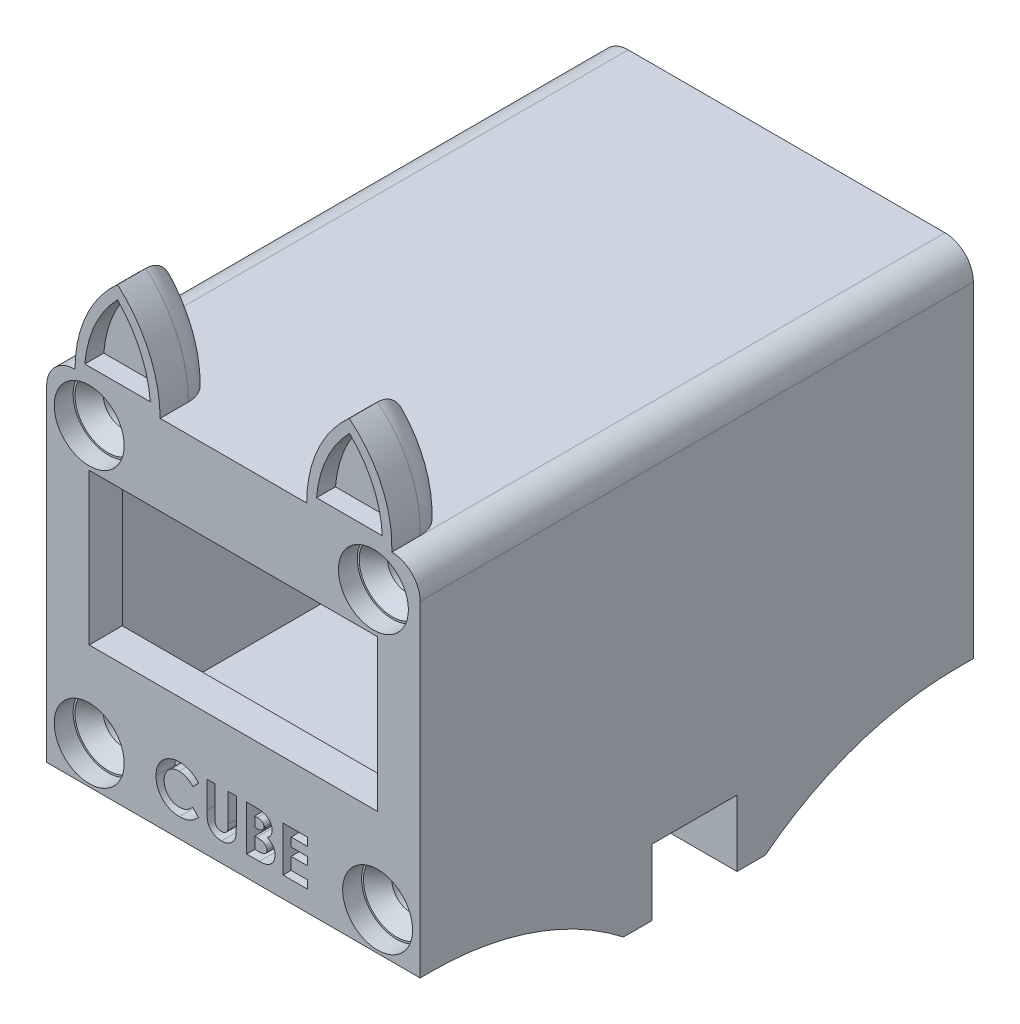
from build123d import *

# Parameters (mm, degrees)
ESQUISSE1_W              = 30.5
ESQUISSE1_H              = 16
BOSS_EXTRU_1_DEPTH       = 3.5
BOSS_EXTRU_2_START       = 55
BOSS_EXTRU_2_DEPTH       = 55
BOSS_EXTRU_3_START       = 1.5
BOSS_EXTRU_3_DEPTH       = 1.5
CONG_1_R                 = 2.5
ESQUISSE8_W              = 12.5
ESQUISSE8_H              = 5
ENL_V_MAT_EXTRU_6_DEPTH  = 2
ESQUISSE4_R              = 2
ENL_V_MAT_EXTRU_1_DEPTH  = 9.5
ESQUISSE5_R              = 3.7
ENL_V_MAT_EXTRU_5_DEPTH  = 2
CHANFREIN1_SIZE          = 1.5
BOSS_EXTRU_5_START       = -24.136848341
BOSS_EXTRU_5_OUTLINE_W   = 7.5
BOSS_EXTRU_5_OUTLINE_H   = 7
BOSS_EXTRU_5_DEPTH       = 6
BOSS_EXTRU_5_START_2     = 4.363151659
BOSS_EXTRU_5_2_OUTLINE_W = 7.5
BOSS_EXTRU_5_2_OUTLINE_H = 7
BOSS_EXTRU_5_2_DEPTH     = 6
BOSS_EXTRU_5_START_3     = -55
BOSS_EXTRU_5_3_OUTLINE_R = 2.25
BOSS_EXTRU_5_3_DEPTH     = 7
ESQUISSE7_W              = 0.5
ESQUISSE7_H              = 2.25
BOSS_EXTRU_6_DEPTH       = 7
BOSS_EXTRU_7_DEPTH       = 6
CONG_2_R                 = 3
ENL_V_MAT_EXTRU_7_DEPTH  = 2
ESQUISSE13_W             = 39.5
ESQUISSE13_H             = 3
BOSS_EXTRU_8_DEPTH       = 7
CONG_3_R                 = 33


with BuildPart() as part:
    # Esquisse1 → Boss.-Extru.1 (new body)
    with BuildSketch(Plane.XY):
        with BuildLine():
            Line((-17.882701422, 11.863151659), (15.617298578, 11.863151659))
            ThreePointArc((15.617298578, 11.863151659), (17.738618922, 10.984472002), (18.617298578, 8.863151659))
            Line((18.617298578, 8.863151659), (18.617298578, -25.636848341))
            Line((18.617298578, -25.636848341), (-20.882701422, -25.636848341))
            Line((-20.882701422, -25.636848341), (-20.882701422, 8.863151659))
            ThreePointArc((-20.882701422, 8.863151659), (-20.004021765, 10.984472002), (-17.882701422, 11.863151659))
        make_face()
        with Locations((-1.132701422, -4.636848341)):
            Rectangle(ESQUISSE1_W, ESQUISSE1_H, mode=Mode.SUBTRACT)
    extrude(amount=BOSS_EXTRU_1_DEPTH)

    # Esquisse2 → Boss.-Extru.2 (add)
    with BuildSketch(Plane(origin=(0, 0, 0), x_dir=(-1, 0, 0), z_dir=(0, 0, -1)).offset(BOSS_EXTRU_2_START)):
        with BuildLine():
            Line((-18.617298578, 8.863151659), (-18.617298578, -25.636848341))
            Line((-18.617298578, -25.636848341), (20.882701422, -25.636848341))
            Line((20.882701422, -25.636848341), (20.882701422, 8.863151659))
            ThreePointArc((20.882701422, 8.863151659), (20.004021765, 10.984472002), (17.882701422, 11.863151659))
            Line((17.882701422, 11.863151659), (-15.617298578, 11.863151659))
            ThreePointArc((-15.617298578, 11.863151659), (-17.738618922, 10.984472002), (-18.617298578, 8.863151659))
        make_face()
        with BuildLine():
            Line((-17.117298578, 8.863151659), (-17.117298578, -24.136848341))
            Line((-17.117298578, -24.136848341), (19.382701422, -24.136848341))
            Line((19.382701422, -24.136848341), (19.382701422, 8.863151659))
            ThreePointArc((19.382701422, 8.863151659), (18.943361594, 9.923811831), (17.882701422, 10.363151659))
            Line((17.882701422, 10.363151659), (-15.617298578, 10.363151659))
            ThreePointArc((-15.617298578, 10.363151659), (-16.67795875, 9.923811831), (-17.117298578, 8.863151659))
        make_face(mode=Mode.SUBTRACT)
    extrude(amount=-BOSS_EXTRU_2_DEPTH)

    # Esquisse3 → Boss.-Extru.3 (add)
    with BuildSketch(Plane(origin=(0, 0, 0), x_dir=(-1, 0, 0), z_dir=(0, 0, -1)).offset(BOSS_EXTRU_3_START)):
        with BuildLine():
            Line((-17.117298578, 8.863151659), (-17.117298578, 5.363151659))
            Line((-17.117298578, 5.363151659), (-5.117298578, 5.363151659))
            Line((-5.117298578, 5.363151659), (-5.117298578, 10.363151659))
            Line((-5.117298578, 10.363151659), (-15.617298578, 10.363151659))
            ThreePointArc((-15.617298578, 10.363151659), (-16.67795875, 9.923811831), (-17.117298578, 8.863151659))
        make_face()
        with BuildLine():
            Line((7.382701422, 5.363151659), (19.382701422, 5.363151659))
            Line((19.382701422, 5.363151659), (19.382701422, 8.863151659))
            ThreePointArc((19.382701422, 8.863151659), (18.943361594, 9.923811831), (17.882701422, 10.363151659))
            Line((17.882701422, 10.363151659), (7.382701422, 10.363151659))
            Line((7.382701422, 10.363151659), (7.382701422, 5.363151659))
        make_face()
        Polygon((-17.117298578, -19.136848341), (-17.117298578, -24.136848341), (19.382701422, -24.136848341), (19.382701422, -19.136848341), (7.382701422, -19.136848341), (7.382701422, -21.636848341), (-5.117298578, -21.636848341), (-5.117298578, -19.136848341), align=None)
    extrude(amount=-BOSS_EXTRU_3_DEPTH)

    # Congé1
    # the kernel refuses this fillet: 2.5 mm, written as the material it takes off along each edge
    with BuildSketch(Plane(origin=(-7.382701422, -21.636848341, -1.5), x_dir=(0, -1, 0), z_dir=(1, 0, 0))) as cong_1_piece_1:
        with BuildLine():
            CenterArc((2.291287847, -2.5), CONG_1_R, 90, 66.421821522)
            Line((0, -1.5), (-0.045825757, -1.48))
            ThreePointArc((-0.045825757, -1.48), (-0.05, -0.75), (-0.05, 0))
            Line((-0.05, 0), (0, 0.05))
            Line((0, 0.05), (2.291287847, 0.05))
            Line((2.291287847, 0.05), (2.291287847, 0))
        make_face()
    extrude(amount=12.5, mode=Mode.SUBTRACT)

    # Esquisse8 → Enlèv. mat.-Extru.6 (cut)
    with BuildSketch(Plane(origin=(0, 0, 0), x_dir=(-1, 0, 0), z_dir=(0, 0, -1))):
        with Locations((1.132701422, 7.863151659)):
            Rectangle(ESQUISSE8_W, ESQUISSE8_H)
    extrude(amount=-ENL_V_MAT_EXTRU_6_DEPTH, mode=Mode.SUBTRACT)

    # Esquisse4 → Enlèv. mat.-Extru.1 (cut)
    with BuildSketch(Plane.XY.offset(3.5)):
        with Locations((-16.382701422, 7.463151659)):
            Circle(ESQUISSE4_R)
        with Locations((13.672123748, 7.463151659)):
            Circle(ESQUISSE4_R)
        with Locations((14.117298578, -21.636848341)):
            Circle(ESQUISSE4_R)
        with Locations((-16.382701422, -21.636848341)):
            Circle(ESQUISSE4_R)
    extrude(amount=-ENL_V_MAT_EXTRU_1_DEPTH, mode=Mode.SUBTRACT)

    # Esquisse5 → Enlèv. mat.-Extru.5 (cut)
    # profile 1 of 8: a face of its own
    with BuildSketch(Plane.XY.offset(3.5)):
        with Locations((-16.382701422, -21.636848341)):
            Circle(ESQUISSE5_R)
    # profile 2 of 8: a face of its own
    with BuildSketch(Plane.XY.offset(3.5)):
        with Locations((13.672123748, 7.463151659)):
            Circle(ESQUISSE5_R)
    # profile 3 of 8: a face of its own
    with BuildSketch(Plane.XY.offset(3.5)):
        with Locations((-16.382701422, 7.463151659)):
            Circle(ESQUISSE5_R)
    # profile 4 of 8: a face of its own
    with BuildSketch(Plane.XY.offset(3.5)):
        with Locations((14.117298578, -21.636848341)):
            Circle(ESQUISSE5_R)
    # profile 5 of 8: a face of its own
    with BuildSketch(Plane.XY.offset(3.5)):
        with BuildLine():
            Line((-4.79616296, -19.522025097), (-5.422958333, -20.121153702))
            add(Edge.make_bspline(
                [(-5.422958333, -20.121153702), (-5.476128223, -20.066175947), (-5.579985675, -19.958787167), (-5.747339116, -19.816613886), (-5.9213806, -19.698131693), (-6.098724499, -19.598346745), (-6.282560715, -19.52285232), (-6.470763601, -19.467838261), (-6.664534888, -19.434298268), (-6.795671842, -19.430460699), (-6.861630208, -19.428530505)],
                knots=[0, 0, 0, 0, 1.115251505, 2.178435587, 3.19620269, 4.182487026, 5.141301733, 6.088180966, 7.038406374, 8, 8, 8, 8], degree=3))
            add(Edge.make_bspline(
                [(-6.861630208, -19.428530505), (-6.916713459, -19.430055426), (-7.025414185, -19.433064689), (-7.185015337, -19.455125555), (-7.337682087, -19.492641019), (-7.483937038, -19.544344276), (-7.623349827, -19.611245548), (-7.756212753, -19.693293053), (-7.882198246, -19.789745786), (-7.999642111, -19.900104696), (-8.107075631, -20.020680098), (-8.201999987, -20.149333765), (-8.281514362, -20.285770958), (-8.346770516, -20.428609942), (-8.397602537, -20.578511845), (-8.433902987, -20.735375748), (-8.454898197, -20.899388464), (-8.458031872, -21.010883086), (-8.459624499, -21.067547933)],
                knots=[0, 0, 0, 0, 1.035432265, 2.043311493, 3.022114605, 3.98653278, 4.95457646, 5.923598177, 6.917315552, 7.932509744, 8.948865224, 9.949768934, 10.933144597, 11.912367597, 12.897413939, 13.903909035, 14.934704909, 16, 16, 16, 16], degree=3))
            add(Edge.make_bspline(
                [(-8.459624499, -21.067547933), (-8.459165522, -21.107319287), (-8.458260869, -21.185709444), (-8.448357848, -21.301670242), (-8.432411647, -21.41417963), (-8.409333545, -21.523067187), (-8.380474151, -21.628427276), (-8.34661551, -21.731168832), (-8.304140344, -21.8298722), (-8.256992268, -21.925683753), (-8.202159599, -22.015989155), (-8.143039867, -22.102102851), (-8.07893417, -22.183602719), (-8.009427291, -22.260155586), (-7.933541008, -22.330565102), (-7.853236701, -22.396948565), (-7.767159746, -22.457644171), (-7.67709818, -22.514175145), (-7.582273986, -22.563284083), (-7.485259963, -22.607767293), (-7.384585183, -22.643894273), (-7.281475423, -22.673015915), (-7.17629916, -22.697779522), (-7.068027672, -22.713027236), (-6.957599538, -22.724574151), (-6.882968655, -22.725287106), (-6.845411758, -22.72564589)],
                knots=[0, 0, 0, 0, 1.103660481, 2.175337485, 3.227646561, 4.255952547, 5.262355991, 6.258840057, 7.255597736, 8.242457506, 9.22035537, 10.185017736, 11.140346927, 12.096287581, 13.051739095, 14.01125915, 14.986044842, 15.97314143, 16.960198552, 17.947847494, 18.933482797, 19.925264591, 20.920966487, 21.929612487, 22.958107872, 24, 24, 24, 24], degree=3))
            add(Edge.make_bspline(
                [(-6.845411758, -22.72564589), (-6.781708807, -22.723803262), (-6.656549074, -22.720182979), (-6.472859169, -22.691872873), (-6.29782099, -22.645304351), (-6.157966322, -22.590309633), (-6.048393884, -22.536001635), (-5.964978007, -22.485769411), (-5.878719488, -22.429579153), (-5.791051009, -22.36531018), (-5.700986472, -22.293733746), (-5.610115724, -22.213282193), (-5.516112458, -22.126604675), (-5.454531851, -22.064741228), (-5.422958333, -22.033022693)],
                knots=[0, 0, 0, 0, 1.404581149, 2.759636711, 4.088442092, 5.392261763, 6.066678138, 6.783632037, 7.538459478, 8.336747902, 9.180226004, 10.074962426, 11.012997595, 12, 12, 12, 12], degree=3))
            Line((-5.422958333, -22.033022693), (-4.815243489, -22.671266383))
            add(Edge.make_bspline(
                [(-4.815243489, -22.671266383), (-4.857962572, -22.712510316), (-4.941341085, -22.793009652), (-5.067115257, -22.907311199), (-5.192731138, -23.010023845), (-5.315154109, -23.104875609), (-5.436389586, -23.18910323), (-5.556424712, -23.262790825), (-5.673900638, -23.327802062), (-5.791256788, -23.383040557), (-5.909223413, -23.429943776), (-6.030597208, -23.470324369), (-6.155749223, -23.504484899), (-6.285443829, -23.532047959), (-6.418471315, -23.554149813), (-6.55607664, -23.569068436), (-6.69738732, -23.579097731), (-6.793240544, -23.579998946), (-6.841595653, -23.580453582)],
                knots=[0, 0, 0, 0, 1.244526981, 2.429050516, 3.560637417, 4.644440555, 5.67424972, 6.652764056, 7.595344123, 8.486817594, 9.369275933, 10.254498637, 11.166417451, 12.086725134, 13.032340136, 13.991389299, 14.986715468, 16, 16, 16, 16], degree=3))
            add(Edge.make_bspline(
                [(-6.841595653, -23.580453582), (-6.930417997, -23.578189323), (-7.104218637, -23.573758799), (-7.358918942, -23.540931609), (-7.600877395, -23.485897403), (-7.830682635, -23.408063857), (-8.04826159, -23.30863515), (-8.253558596, -23.186740224), (-8.44624276, -23.042702934), (-8.624757574, -22.878211537), (-8.786232719, -22.696544599), (-8.928958047, -22.501484145), (-9.047020444, -22.292071527), (-9.145050197, -22.071400435), (-9.221708173, -21.838463864), (-9.275662394, -21.593009846), (-9.308935567, -21.335275383), (-9.3125757, -21.159236804), (-9.314432191, -21.069455986)],
                knots=[0, 0, 0, 0, 1.078019885, 2.10938526, 3.111377082, 4.085535484, 5.04941344, 6.010039228, 6.978205633, 7.964457913, 8.951525778, 9.924444315, 10.892603023, 11.863865945, 12.85144698, 13.863884204, 14.910567087, 16, 16, 16, 16], degree=3))
            add(Edge.make_bspline(
                [(-9.314432191, -21.069455986), (-9.313647728, -21.010901703), (-9.312093114, -20.894861425), (-9.295753973, -20.723924693), (-9.272976261, -20.557291956), (-9.236841492, -20.396693414), (-9.193284592, -20.239965506), (-9.139115864, -20.088811684), (-9.074421823, -19.942797515), (-9.00128771, -19.801678564), (-8.91855182, -19.66637931), (-8.826126748, -19.538062187), (-8.726391876, -19.415736611), (-8.616950738, -19.301025457), (-8.499393656, -19.19292154), (-8.373189874, -19.092010695), (-8.239098445, -18.996845747), (-8.096756432, -18.909880768), (-7.948929162, -18.831216323), (-7.797481126, -18.761830923), (-7.642784415, -18.703840706), (-7.485493098, -18.655739961), (-7.324942624, -18.619836155), (-7.162278961, -18.592658133), (-6.996118035, -18.577465445), (-6.884555368, -18.574978305), (-6.828239282, -18.573722813)],
                knots=[0, 0, 0, 0, 1.071919942, 2.124283339, 3.142214191, 4.149696895, 5.136002878, 6.119640489, 7.086990633, 8.058538607, 9.028339693, 9.988281803, 10.952401235, 11.916291999, 12.888973767, 13.874849856, 14.873389453, 15.898127285, 16.927174885, 17.938320013, 18.946391617, 19.950418109, 20.947802303, 21.956882652, 22.968648068, 24, 24, 24, 24], degree=3))
            add(Edge.make_bspline(
                [(-6.828239282, -18.573722813), (-6.780195887, -18.574442492), (-6.684608614, -18.575874368), (-6.542263123, -18.587810608), (-6.401056046, -18.606556354), (-6.261492945, -18.634839692), (-6.122575524, -18.668415588), (-5.986129313, -18.712378592), (-5.850001799, -18.761383646), (-5.71632794, -18.819959181), (-5.584921146, -18.883899669), (-5.45885983, -18.956442474), (-5.336027433, -19.033123394), (-5.219145847, -19.118480741), (-5.106025629, -19.209418445), (-4.997258294, -19.306360783), (-4.893798339, -19.410924067), (-4.828872616, -19.484804199), (-4.79616296, -19.522025097)],
                knots=[0, 0, 0, 0, 0.996412454, 1.982464992, 2.961075852, 3.949442424, 4.934965278, 5.923860011, 6.921385422, 7.934793307, 8.949617135, 9.951082467, 10.950285876, 11.951772932, 12.951063433, 13.960125323, 14.972308753, 16, 16, 16, 16], degree=3))
        make_face()
    # profile 6 of 8: a face of its own
    with BuildSketch(Plane.XY.offset(3.5)):
        with BuildLine():
            Line((-3.941355268, -18.695838198), (-3.086547576, -18.695838198))
            Line((-3.086547576, -18.695838198), (-3.086547576, -21.794516082))
            add(Edge.make_bspline(
                [(-3.086547576, -21.794516082), (-3.086501095, -21.82664183), (-3.086411319, -21.888692381), (-3.081917082, -21.977714606), (-3.077804545, -22.059544671), (-3.070384361, -22.134092987), (-3.059422206, -22.201391446), (-3.048807263, -22.261872347), (-3.034440987, -22.31445285), (-3.012850772, -22.374303228), (-2.979587337, -22.441548396), (-2.92523673, -22.511632853), (-2.862520779, -22.575595093), (-2.7873521, -22.628834838), (-2.702869152, -22.671900993), (-2.609536132, -22.703808247), (-2.507484605, -22.721544444), (-2.436921573, -22.7242522), (-2.400602564, -22.72564589)],
                knots=[0, 0, 0, 0, 1.155499968, 2.231836252, 3.205919964, 4.102923608, 4.924856345, 5.658536265, 6.31071849, 6.882491295, 7.94666036, 8.992281882, 10.060072772, 11.158554251, 12.289267114, 13.461410017, 14.693379945, 16, 16, 16, 16], degree=3))
            add(Edge.make_bspline(
                [(-2.400602564, -22.72564589), (-2.362018098, -22.724519967), (-2.286784923, -22.722324609), (-2.178573978, -22.700774789), (-2.078315923, -22.666460095), (-1.988133564, -22.617484282), (-1.908116647, -22.558778187), (-1.840384003, -22.491834842), (-1.78692965, -22.416520728), (-1.752090091, -22.347037723), (-1.732529394, -22.283084668), (-1.717867678, -22.22594504), (-1.707119017, -22.158525934), (-1.697367479, -22.081880247), (-1.691507556, -21.995214075), (-1.685153425, -21.899224399), (-1.682824577, -21.793254433), (-1.682427642, -21.719465557), (-1.682220653, -21.680986936)],
                knots=[0, 0, 0, 0, 1.261321664, 2.459363699, 3.594844139, 4.716940403, 5.803436589, 6.833651888, 7.818396249, 8.814403945, 9.360733334, 10.004355033, 10.743453831, 11.592799886, 12.532235708, 13.585170094, 14.740740724, 16, 16, 16, 16], degree=3))
            Line((-1.682220653, -21.680986936), (-1.682220653, -18.695838198))
            Line((-1.682220653, -18.695838198), (-0.82741296, -18.695838198))
            Line((-0.82741296, -18.695838198), (-0.82741296, -21.536928943))
            add(Edge.make_bspline(
                [(-0.82741296, -21.536928943), (-0.827531666, -21.594489305), (-0.827759925, -21.705172269), (-0.831265299, -21.864231477), (-0.838727607, -22.00950655), (-0.844995084, -22.141039935), (-0.857124799, -22.258654437), (-0.869761117, -22.362852302), (-0.885867191, -22.453264277), (-0.909832061, -22.556187323), (-0.951188332, -22.674699442), (-1.017860063, -22.811161009), (-1.102495509, -22.944765148), (-1.202530378, -23.074042124), (-1.315478894, -23.194136267), (-1.438836749, -23.299563381), (-1.570644092, -23.38874335), (-1.712278216, -23.459495618), (-1.863618583, -23.514677053), (-2.026162592, -23.551756198), (-2.199799403, -23.576807333), (-2.319733629, -23.579213803), (-2.381522035, -23.580453582)],
                knots=[0, 0, 0, 0, 1.170808336, 2.251350247, 3.235597562, 4.129743112, 4.929140599, 5.639994148, 6.264258765, 6.79612947, 7.788252245, 8.809469599, 9.879094798, 10.999557536, 12.129761673, 13.226370002, 14.293821979, 15.358369427, 16.438775801, 17.562147481, 18.744053101, 20, 20, 20, 20], degree=3))
            add(Edge.make_bspline(
                [(-2.381522035, -23.580453582), (-2.422575481, -23.579762091), (-2.503573087, -23.578397793), (-2.622694277, -23.566368251), (-2.737848307, -23.54864123), (-2.848818803, -23.52277933), (-2.955990924, -23.489370587), (-3.059336196, -23.44824675), (-3.158470563, -23.399637204), (-3.252839283, -23.343989052), (-3.342326228, -23.283815154), (-3.424112676, -23.217109855), (-3.501013091, -23.148806264), (-3.570805853, -23.076029876), (-3.634015167, -22.999544719), (-3.690510853, -22.919177451), (-3.740208978, -22.834935213), (-3.78435967, -22.745299542), (-3.822148354, -22.645714581), (-3.854005634, -22.532638051), (-3.881836903, -22.404297592), (-3.90251946, -22.260404059), (-3.921270388, -22.101431708), (-3.933138692, -21.926966393), (-3.939347536, -21.737003108), (-3.940669113, -21.605305501), (-3.941355268, -21.536928943)],
                knots=[0, 0, 0, 0, 1.001158378, 1.975264943, 2.917723546, 3.841610987, 4.75185031, 5.653588123, 6.552117133, 7.442167995, 8.324307438, 9.179605724, 10.014504199, 10.831958861, 11.636465792, 12.43274043, 13.225645099, 14.020104002, 14.867201867, 15.819789774, 16.883317127, 18.068162734, 19.364263498, 20.787406516, 22.332041935, 24, 24, 24, 24], degree=3))
            Line((-3.941355268, -21.536928943), (-3.941355268, -18.695838198))
        make_face()
    # profile 7 of 8: a face of its own
    with BuildSketch(Plane.XY.offset(3.5)):
        with BuildLine():
            Line((0.271625501, -23.458338198), (0.271625501, -18.695838198))
            Line((0.271625501, -18.695838198), (1.034846655, -18.695838198))
            add(Edge.make_bspline(
                [(1.034846655, -18.695838198), (1.088276908, -18.6958321), (1.191663435, -18.695820301), (1.340823211, -18.701058303), (1.479156307, -18.707834244), (1.606222492, -18.715414948), (1.722238043, -18.728478014), (1.827026538, -18.742245059), (1.920797346, -18.758847267), (1.978770741, -18.773739962), (2.006045573, -18.780746551)],
                knots=[0, 0, 0, 0, 1.311965854, 2.538629056, 3.664479157, 4.713267157, 5.663616078, 6.530575999, 7.308677837, 8, 8, 8, 8], degree=3))
            add(Edge.make_bspline(
                [(2.006045573, -18.780746551), (2.041860197, -18.790629469), (2.112139987, -18.810022928), (2.212803073, -18.849188857), (2.308296052, -18.892724563), (2.398502329, -18.942390661), (2.482868003, -18.998786761), (2.561072454, -19.062360437), (2.634802359, -19.130559847), (2.701439738, -19.205285688), (2.761668949, -19.284247381), (2.813997335, -19.367424236), (2.859463995, -19.453544424), (2.895849233, -19.543691712), (2.923264826, -19.637450946), (2.943316476, -19.734421759), (2.956312661, -19.834910993), (2.95754063, -19.903277102), (2.958163963, -19.937980625)],
                knots=[0, 0, 0, 0, 1.099996261, 2.158545794, 3.195537121, 4.207578794, 5.205712374, 6.197378256, 7.190519799, 8.17788031, 9.159561366, 10.129234751, 11.085776129, 12.040971148, 13.00380137, 13.975669004, 14.972423361, 16, 16, 16, 16], degree=3))
            add(Edge.make_bspline(
                [(2.958163963, -19.937980625), (2.956534132, -19.982565543), (2.953326011, -20.070325476), (2.932832315, -20.19922894), (2.894403441, -20.321061241), (2.844120195, -20.438067703), (2.7757507, -20.54981189), (2.688934665, -20.656240672), (2.585078224, -20.76063115), (2.505414601, -20.8232062), (2.463978266, -20.855754063)],
                knots=[0, 0, 0, 0, 0.986156485, 1.941127874, 2.875419072, 3.804401753, 4.751181392, 5.761612777, 6.835722519, 8, 8, 8, 8], degree=3))
            add(Edge.make_bspline(
                [(2.463978266, -20.855754063), (2.497556284, -20.87289535), (2.563393487, -20.906504671), (2.656862974, -20.961748363), (2.743405516, -21.020507035), (2.823409143, -21.081598439), (2.895195688, -21.14761233), (2.961729338, -21.214744895), (3.019727668, -21.286842552), (3.071591522, -21.361335603), (3.116670742, -21.439302715), (3.155929771, -21.520612221), (3.189090465, -21.60554189), (3.217171798, -21.6936595), (3.238114864, -21.785268134), (3.251770188, -21.880400556), (3.262225558, -21.978732314), (3.263038887, -22.045713452), (3.263452424, -22.079769988)],
                knots=[0, 0, 0, 0, 1.164658916, 2.283573913, 3.35186032, 4.395461096, 5.390182219, 6.362969632, 7.312859996, 8.245001507, 9.165155236, 10.092416118, 11.032087915, 11.979892451, 12.947605196, 13.931445124, 14.948243989, 16, 16, 16, 16], degree=3))
            add(Edge.make_bspline(
                [(3.263452424, -22.079769988), (3.260768845, -22.144816026), (3.255472812, -22.27318412), (3.216750801, -22.461657964), (3.149619138, -22.640348263), (3.059475158, -22.808544824), (2.94840043, -22.961378634), (2.820696346, -23.095259725), (2.677648593, -23.208587097), (2.545669751, -23.28507428), (2.431518446, -23.336404333), (2.336969053, -23.368139809), (2.235425009, -23.397539506), (2.125026271, -23.41818458), (2.007774217, -23.437081222), (1.882525634, -23.4487484), (1.749514607, -23.456654959), (1.658156884, -23.457765775), (1.611078626, -23.458338198)],
                knots=[0, 0, 0, 0, 1.284142165, 2.534249414, 3.780121997, 5.041676246, 6.291546858, 7.49970053, 8.684500223, 9.883330709, 10.50184324, 11.153274765, 11.851151195, 12.587658647, 13.369265475, 14.195992086, 15.070362669, 16, 16, 16, 16], degree=3))
            Line((1.611078626, -23.458338198), (0.271625501, -23.458338198))
        make_face()
        with BuildLine():
            Line((1.126433194, -19.55064589), (1.126433194, -20.588626659))
            Line((1.126433194, -20.588626659), (1.353491487, -20.588626659))
            add(Edge.make_bspline(
                [(1.353491487, -20.588626659), (1.384350749, -20.588357555), (1.443922687, -20.587838065), (1.529968032, -20.581147216), (1.609976307, -20.569732212), (1.683644059, -20.553805411), (1.751657528, -20.533580695), (1.813582225, -20.509246007), (1.869145878, -20.479555042), (1.933697992, -20.435329039), (2.001934232, -20.370248496), (2.062001826, -20.276226167), (2.097381238, -20.168100847), (2.101321551, -20.091842499), (2.103356271, -20.052463799)],
                knots=[0, 0, 0, 0, 1.065314748, 2.056525647, 2.977365736, 3.853934255, 4.656397591, 5.425096493, 6.14721249, 6.826394842, 8.123232004, 9.372140726, 10.643011755, 12, 12, 12, 12], degree=3))
            add(Edge.make_bspline(
                [(2.103356271, -20.052463799), (2.101728122, -20.015579103), (2.098580163, -19.944264027), (2.062957644, -19.844131309), (2.007628829, -19.755393228), (1.942305387, -19.694659268), (1.880790672, -19.653179764), (1.828117999, -19.625867277), (1.770305785, -19.601417418), (1.706234847, -19.582722459), (1.636271066, -19.568694421), (1.560754296, -19.558392507), (1.479554242, -19.551380586), (1.423469193, -19.550896041), (1.394514624, -19.55064589)],
                knots=[0, 0, 0, 0, 1.347982417, 2.606269829, 3.849316587, 5.153353503, 5.842674298, 6.568177932, 7.326619318, 8.142485038, 9.012069166, 9.942760135, 10.937925643, 12, 12, 12, 12], degree=3))
            Line((1.394514624, -19.55064589), (1.126433194, -19.55064589))
        make_face(mode=Mode.SUBTRACT)
        with BuildLine():
            Line((1.126433194, -21.382376659), (1.126433194, -22.603530505))
            Line((1.126433194, -22.603530505), (1.372572016, -22.603530505))
            add(Edge.make_bspline(
                [(1.372572016, -22.603530505), (1.421233974, -22.603252501), (1.514792662, -22.602718004), (1.648815316, -22.596260005), (1.770675414, -22.584620601), (1.880050073, -22.570089742), (1.977106821, -22.550402701), (2.061517583, -22.525373152), (2.134439943, -22.497836288), (2.195436655, -22.463824991), (2.245267474, -22.424244276), (2.290234564, -22.383791835), (2.326897927, -22.337126122), (2.355906664, -22.286250367), (2.381013674, -22.232428361), (2.39615645, -22.173558373), (2.407685628, -22.111385169), (2.40832011, -22.068381309), (2.408644732, -22.046379063)],
                knots=[0, 0, 0, 0, 1.753078804, 3.370512758, 4.83203934, 6.162291463, 7.344201807, 8.395507345, 9.331626367, 10.147333109, 10.898971645, 11.62040215, 12.321813352, 13.025280112, 13.727906689, 14.453419512, 15.208716525, 16, 16, 16, 16], degree=3))
            add(Edge.make_bspline(
                [(2.408644732, -22.046379063), (2.407928846, -22.021219149), (2.406534494, -21.972214404), (2.395146798, -21.90058874), (2.374451636, -21.83372143), (2.348385069, -21.769902588), (2.312112056, -21.711417149), (2.26900282, -21.656241154), (2.216915857, -21.606243034), (2.158341029, -21.558398715), (2.090019292, -21.516508421), (2.01191859, -21.480161171), (1.923614639, -21.449805287), (1.824833907, -21.425635912), (1.716009442, -21.405123697), (1.596346944, -21.39287564), (1.466843004, -21.383766223), (1.377042865, -21.382850372), (1.330594852, -21.382376659)],
                knots=[0, 0, 0, 0, 0.845221588, 1.646264278, 2.427170338, 3.19324141, 3.95557735, 4.731569926, 5.540061037, 6.376114724, 7.268642756, 8.224665384, 9.265483498, 10.400594375, 11.639216012, 12.983232105, 14.439614077, 16, 16, 16, 16], degree=3))
            Line((1.330594852, -21.382376659), (1.126433194, -21.382376659))
        make_face(mode=Mode.SUBTRACT)
    # profile 8 of 8: a face of its own
    with BuildSketch(Plane.XY.offset(3.5)):
        Polygon((4.118260117, -18.695838198), (6.682683194, -18.695838198), (6.682683194, -19.55064589), (4.973067809, -19.55064589), (4.973067809, -20.466511274), (6.682683194, -20.466511274), (6.682683194, -21.321318967), (4.973067809, -21.321318967), (4.973067809, -22.603530505), (6.682683194, -22.603530505), (6.682683194, -23.458338198), (4.118260117, -23.458338198), align=None)
    extrude(amount=-ENL_V_MAT_EXTRU_5_DEPTH, mode=Mode.SUBTRACT)

    # Chanfrein1
    chanfrein1_edges = [part.edges().sort_by_distance(p)[0] for p in [
        (-18.382701422, -21.636848341, 1.5),
        (11.672123748, 7.463151659, 1.5),
        (-18.382701422, 7.463151659, 1.5),
        (12.117298578, -21.636848341, 1.5),
    ]]
    chamfer(chanfrein1_edges, length=CHANFREIN1_SIZE)

    # Boss.-Extru.5: read off the stored shape, not the designer's step
    # Boss.-Extru.5 outline → Boss.-Extru.5 (add)
    with BuildSketch(Plane(origin=(0, 0, 0), x_dir=(1, 0, 0), z_dir=(0, 1, 0)).offset(BOSS_EXTRU_5_START)):
        with Locations((-1.132701422, 51.5)):
            Rectangle(BOSS_EXTRU_5_OUTLINE_W, BOSS_EXTRU_5_OUTLINE_H)
    extrude(amount=BOSS_EXTRU_5_DEPTH)

    # Boss.-Extru.5 2 outline → Boss.-Extru.5 2 (add)
    with BuildSketch(Plane(origin=(0, 0, 0), x_dir=(1, 0, 0), z_dir=(0, 1, 0)).offset(BOSS_EXTRU_5_START_2)):
        with Locations((-1.132701422, 51.5)):
            Rectangle(BOSS_EXTRU_5_2_OUTLINE_W, BOSS_EXTRU_5_2_OUTLINE_H)
    extrude(amount=BOSS_EXTRU_5_2_DEPTH)

    # Boss.-Extru.5 3 outline → Boss.-Extru.5 3 (cut)
    with BuildSketch(Plane.XY.offset(BOSS_EXTRU_5_START_3)):
        with BuildLine():
            Line((-4.882701422, -18.136848341), (-4.882701422, -21.886848341))
            ThreePointArc((-4.882701422, -21.886848341), (-3.784351851, -19.235197912), (-1.132701422, -18.136848341))
            Line((-1.132701422, -18.136848341), (-4.882701422, -18.136848341))
        make_face()
        with BuildLine():
            Line((2.617298578, -18.136848341), (-1.132701422, -18.136848341))
            ThreePointArc((-1.132701422, -18.136848341), (1.518949007, -19.235197912), (2.617298578, -21.886848341))
            Line((2.617298578, -21.886848341), (2.617298578, -18.136848341))
        make_face()
        with Locations((-1.132701422, -21.886848341)):
            Circle(BOSS_EXTRU_5_3_OUTLINE_R)
        with BuildLine():
            Line((2.617298578, 4.363151659), (2.617298578, 8.113151659))
            ThreePointArc((2.617298578, 8.113151659), (1.518949007, 5.46150123), (-1.132701422, 4.363151659))
            Line((-1.132701422, 4.363151659), (2.617298578, 4.363151659))
        make_face()
        with BuildLine():
            Line((-4.882701422, 4.363151659), (-1.132701422, 4.363151659))
            ThreePointArc((-1.132701422, 4.363151659), (-3.784351851, 5.46150123), (-4.882701422, 8.113151659))
            Line((-4.882701422, 8.113151659), (-4.882701422, 4.363151659))
        make_face()
        with Locations((-1.132701422, 8.113151659)):
            Circle(BOSS_EXTRU_5_3_OUTLINE_R)
    extrude(amount=BOSS_EXTRU_5_3_DEPTH, mode=Mode.SUBTRACT)

    # Esquisse7 → Boss.-Extru.6 (add)
    with BuildSketch(Plane(origin=(0, 0, -55), x_dir=(-1, 0, 0), z_dir=(0, 0, -1))):
        with BuildLine():
            Line((-2.617298578, 8.113151659), (-3.117298578, 8.113151659))
            ThreePointArc((-3.117298578, 8.113151659), (1.132701422, 3.863151659), (5.382701422, 8.113151659))
            Line((5.382701422, 8.113151659), (4.882701422, 8.113151659))
            ThreePointArc((4.882701422, 8.113151659), (1.132701422, 4.363151659), (-2.617298578, 8.113151659))
        make_face()
        with Locations((5.132701422, 9.238151659)):
            Rectangle(ESQUISSE7_W, ESQUISSE7_H)
        with Locations((-2.867298578, 9.238151659)):
            Rectangle(ESQUISSE7_W, ESQUISSE7_H)
    extrude(amount=-BOSS_EXTRU_6_DEPTH)

    # Esquisse10 → Boss.-Extru.7 (add)
    with BuildSketch(Plane.XY.offset(3.5)):
        with BuildLine():
            ThreePointArc((11.117298578, 21.863151659), (7.794125134, 17.346079709), (6.617298578, 11.863151659))
            Line((6.617298578, 11.863151659), (15.617298578, 11.863151659))
            ThreePointArc((15.617298578, 11.863151659), (14.552498082, 17.396491435), (11.117298578, 21.863151659))
        make_face()
        with BuildLine():
            ThreePointArc((-13.382701422, 21.863151659), (-16.705874866, 17.346079709), (-17.882701422, 11.863151659))
            Line((-17.882701422, 11.863151659), (-8.882701422, 11.863151659))
            ThreePointArc((-8.882701422, 11.863151659), (-10.059527978, 17.346079709), (-13.382701422, 21.863151659))
        make_face()
    extrude(amount=-BOSS_EXTRU_7_DEPTH)

    # Congé2
    cong_2_edges = [part.edges().sort_by_distance(p)[0] for p in [
        (14.552498082, 17.396491435, -2.5),
        (7.794125134, 17.346079709, -2.5),
        (-10.059527978, 17.346079709, -2.5),
        (-16.705874866, 17.346079709, -2.5),
    ]]
    fillet(cong_2_edges, radius=CONG_2_R)

    # Esquisse12 → Enlèv. mat.-Extru.7 (cut)
    with BuildSketch(Plane.XY.offset(3.5)):
        with BuildLine():
            Line((-16.842185585, 12.863151659), (-9.923217259, 12.863151659))
            ThreePointArc((-9.923217259, 12.863151659), (-10.988751984, 16.973991114), (-13.382701422, 20.481607308))
            ThreePointArc((-13.382701422, 20.481607308), (-15.77665086, 16.973991114), (-16.842185585, 12.863151659))
        make_face()
        with BuildLine():
            Line((7.657814415, 12.863151659), (14.613493533, 12.863151659))
            ThreePointArc((14.613493533, 12.863151659), (13.610784732, 17.017800918), (11.140908559, 20.505815696))
            ThreePointArc((11.140908559, 20.505815696), (8.730350334, 16.989381135), (7.657814415, 12.863151659))
        make_face()
    extrude(amount=-ENL_V_MAT_EXTRU_7_DEPTH, mode=Mode.SUBTRACT)

    # Esquisse13 → Boss.-Extru.8 (add)
    with BuildSketch(Plane.XZ.offset(25.636848341)):
        with Locations((-1.132701422, -19.5)):
            Rectangle(ESQUISSE13_W, ESQUISSE13_H)
        with Locations((-1.132701422, -31.5)):
            Rectangle(ESQUISSE13_W, ESQUISSE13_H)
    extrude(amount=BOSS_EXTRU_8_DEPTH)

    # Congé3
    # the kernel refuses this fillet: 33 mm, written as the material it adds along each edge
    with BuildSketch(Plane(origin=(-20.882701422, -25.636848341, -18), x_dir=(0, 0, 1), z_dir=(1, 0, 0))) as cong_3_piece_1:
        with BuildLine():
            CenterArc((20.322401433, 33), CONG_3_R, 231.987720456, 38.012279544)
            Line((0, 7), (0, 0))
            Line((0, 0), (20.322401433, 0))
        make_face()
    extrude(amount=39.5)
    with BuildSketch(Plane(origin=(-20.882701422, -25.636848341, -33), x_dir=(0, 0, -1), z_dir=(1, 0, 0))) as cong_3_piece_2:
        with BuildLine():
            CenterArc((20.322401433, -33), CONG_3_R, 90, 38.012279544)
            Line((0, -7), (0, 0))
            Line((0, 0), (20.322401433, 0))
        make_face()
    extrude(amount=39.5)


solid = part.part
